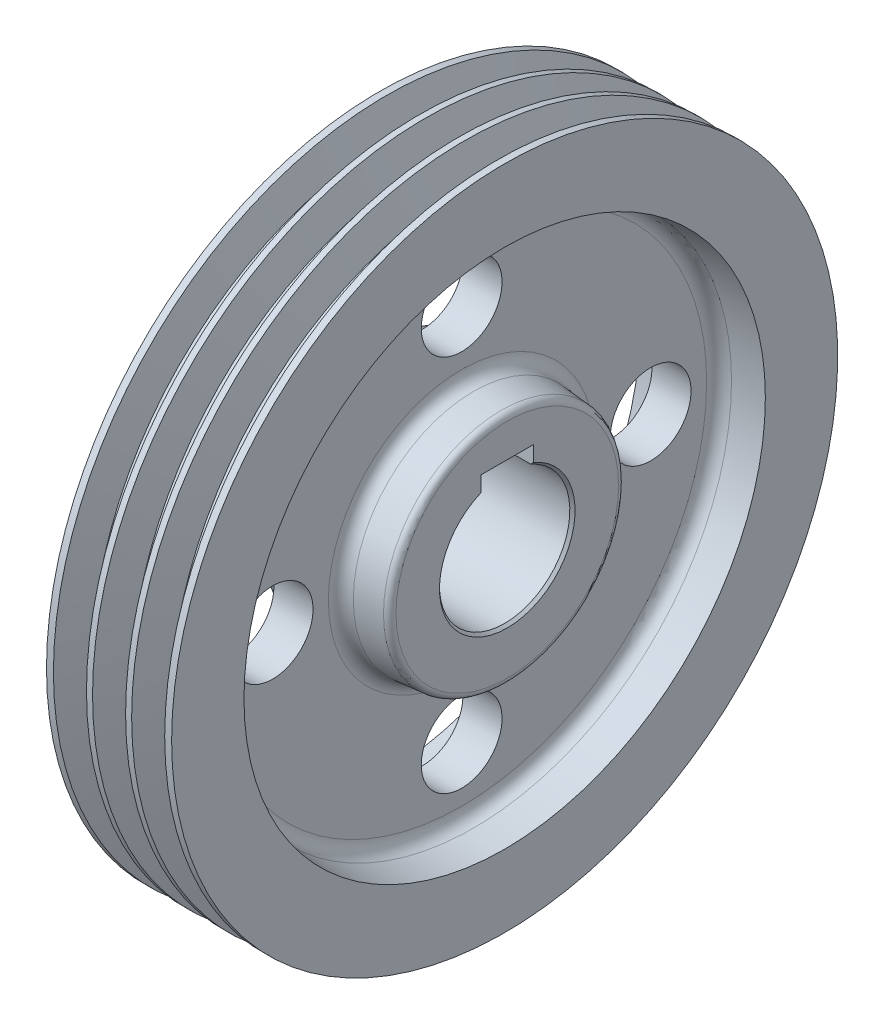
from build123d import *

# Parameters (mm, degrees)
PATTERN_LINEAR_979_COUNT    = 3
PATTERN_LINEAR_979_PITCH    = 15
CHAMFER_1_SIZE              = 1
SKETCH_4_W                  = 20
SKETCH_4_H                  = 6.987121525
CUT_EXTRUDE_1_DEPTH         = 188.456995068
FILLET_1_R                  = 5
FILLET_2_R                  = 2.5
SKETCH_5_R                  = 15.5
CUT_EXTRUDE_2_DEPTH         = 188.192748257
PATTERN_CIRCULAR_1810_COUNT = 4


with BuildPart() as part:
    # 草图1 → 旋转1 (revolve)
    with BuildSketch(Plane.XY):
        Polygon((-1, 25), (-1, 45), (16.5, 46.531051612), (16.5, 98.556437052), (0, 100), (0, 127.75), (48, 127.75), (48, 100), (31.5, 98.556437052), (31.5, 46.531051612), (49, 45), (49, 25), align=None)
    revolve(axis=Axis((0, 0, 0), (1, 0, 0)))

    # 草图2 → 切除-旋转1 (revolve, cut)
    with BuildSketch(Plane.XY):
        Polygon((11.840143071, 116.3), (15.340759374, 127.75), (2.659240626, 127.75), (6.159856929, 116.3), align=None)
    cut_revolve_1 = revolve(axis=Axis((0, 0, 0), (1, 0, 0)), mode=Mode.SUBTRACT)

    # Pattern Linear 979: 切除-旋转1 ×3
    with Locations(*[(i * PATTERN_LINEAR_979_PITCH, 0, 0) for i in range(1, PATTERN_LINEAR_979_COUNT)]):
        add(cut_revolve_1, mode=Mode.SUBTRACT)

    # 倒角1
    chamfer_1_edges = [part.edges().sort_by_distance(p)[0] for p in [
        (-1, -25, 0),
        (49, -25, 0),
    ]]
    chamfer(chamfer_1_edges, length=CHAMFER_1_SIZE)

    # 草图4 → 切除-拉伸1 (cut, through all)
    with BuildSketch(Plane.ZY.offset(1)):
        with Locations((0, 26.406439238)):
            Rectangle(SKETCH_4_W, SKETCH_4_H)
    extrude(amount=-CUT_EXTRUDE_1_DEPTH, mode=Mode.SUBTRACT)

    # 圆角1
    fillet_1_edges = [part.edges().sort_by_distance(p)[0] for p in [
        (31.5, -98.556437052, 0),
        (16.5, -46.531051612, 0),
        (16.5, -98.556437052, 0),
        (31.5, -46.531051612, 0),
    ]]
    fillet(fillet_1_edges, radius=FILLET_1_R)

    # 圆角2
    fillet_2_edges = [part.edges().sort_by_distance(p)[0] for p in [
        (49, -45, 0),
        (-1, -45, 0),
    ]]
    fillet(fillet_2_edges, radius=FILLET_2_R)

    # 草图5 → 切除-拉伸2 (cut, through all)
    with BuildSketch(Plane(origin=(0, 0, 0), x_dir=(0, 0, -1), z_dir=(1, 0, 0))):
        with Locations((0, 72.5)):
            Circle(SKETCH_5_R)
    cut_extrude_2 = extrude(amount=CUT_EXTRUDE_2_DEPTH, mode=Mode.SUBTRACT)

    # Pattern Circular 1810: 切除-拉伸2 ×4 about axis
    pattern_circular_1810_axis = Axis((0, 0, 0), (1, 0, 0))
    for i in range(1, PATTERN_CIRCULAR_1810_COUNT):
        add(cut_extrude_2.rotate(pattern_circular_1810_axis, i * 360 / PATTERN_CIRCULAR_1810_COUNT), mode=Mode.SUBTRACT)


solid = part.part
